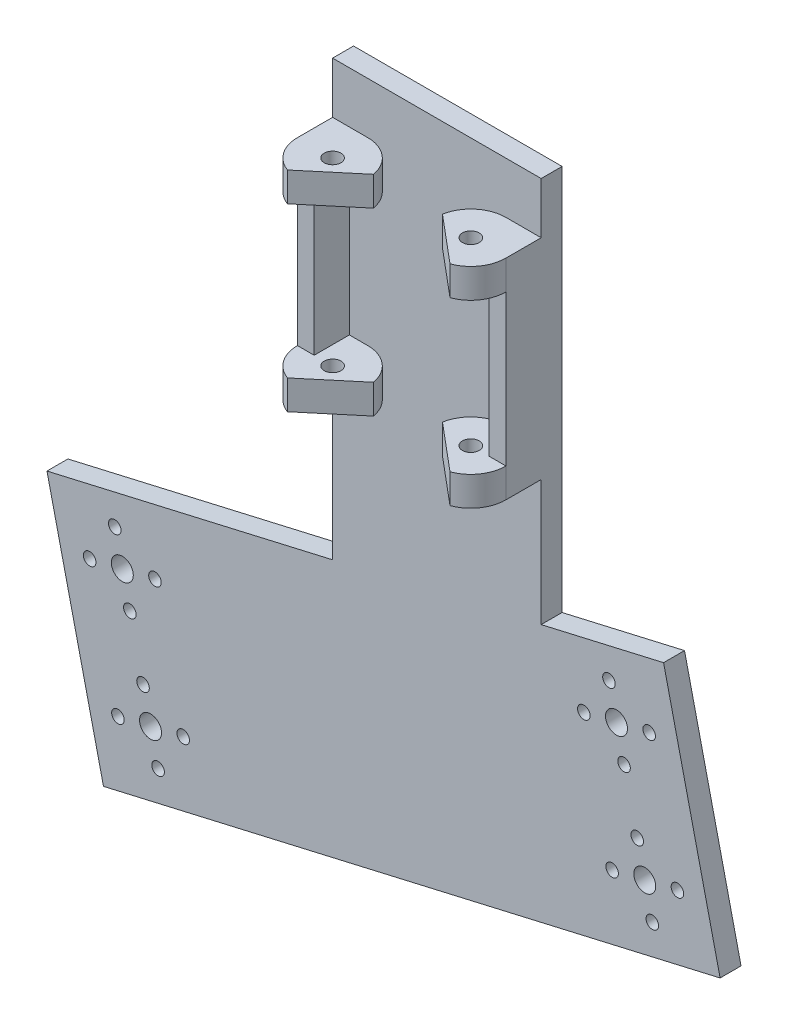
from build123d import *

# Parameters (mm, degrees)
BOSS_EXTRUDE2_DEPTH     = 7
CUT_EXTRUDE2_DEPTH      = 30.130224853
CUT_EXTRUDE2_DEPTH_BACK = 30.130224853
SKETCH3_R               = 2
BOSS_EXTRUDE3_DEPTH     = 36
SKETCH5_R               = 2
BOSS_EXTRUDE4_DEPTH     = 7
SKETCH13_W              = 49.8
SKETCH13_H              = 5
BOSS_EXTRUDE6_DEPTH     = 12.25
SKETCH15_W              = 49.8
SKETCH15_H              = 5
BOSS_EXTRUDE7_DEPTH     = 30
BOSS_EXTRUDE8_DEPTH     = 5
CUT_EXTRUDE3_DEPTH      = 150.404134049
CUT_EXTRUDE3_DEPTH_BACK = 150.404134049
SKETCH16_R              = 2.625
SKETCH16_R_2            = 1.5


with BuildPart() as part:
    # Sketch1 → Boss-Extrude2 (new body)
    with BuildSketch(Plane(origin=(0, 0, 0), x_dir=(1, 0, 0), z_dir=(0, 1, 0))):
        with BuildLine():
            Line((-24.9, 0), (-24.9, 13.4))
            Line((-24.9, 13.4), (24.9, 13.4))
            Line((24.9, 13.4), (24.9, 0))
            ThreePointArc((24.9, 0), (23.392904185, -4.800819919), (19.412411454, -7.878950407))
            Line((19.412411454, -7.878950407), (8.235013612, 1.5))
            ThreePointArc((8.235013612, 1.5), (11.116692467, 6.448255578), (16.5, 8.4))
            Line((16.5, 8.4), (-16.5, 8.4))
            ThreePointArc((-16.5, 8.4), (-11.116692467, 6.448255578), (-8.235013612, 1.5))
            Line((-8.235013612, 1.5), (-19.412411454, -7.878950407))
            ThreePointArc((-19.412411454, -7.878950407), (-23.392904185, -4.800819919), (-24.9, 0))
        make_face()
    extrude(amount=BOSS_EXTRUDE2_DEPTH)

    # Sketch3 → Cut-Extrude2 (cut, two sides: drawn at the far end of the back side and taken through both)
    with BuildSketch(Plane(origin=(0, 7, 0), x_dir=(1, 0, 0), z_dir=(0, 1, 0)).offset(-CUT_EXTRUDE2_DEPTH_BACK)):
        with Locations((-16.5, 0)):
            Circle(SKETCH3_R)
        with Locations((16.5, 0)):
            Circle(SKETCH3_R)
    extrude(amount=CUT_EXTRUDE2_DEPTH + CUT_EXTRUDE2_DEPTH_BACK, mode=Mode.SUBTRACT)

    # Sketch4 → Boss-Extrude3 (add)
    with BuildSketch(Plane(origin=(0, 7, 0), x_dir=(1, 0, 0), z_dir=(0, 1, 0))):
        Polygon((-24.9, 13.4), (-24.9, 0), (-20.9, 0), (-20.9, 8.4), (-16.5, 8.4), (16.5, 8.4), (20.9, 8.4), (20.9, 0), (24.9, 0), (24.9, 13.4), align=None)
    extrude(amount=BOSS_EXTRUDE3_DEPTH)

    # Sketch5 → Boss-Extrude4 (add)
    with BuildSketch(Plane(origin=(0, 43, 0), x_dir=(1, 0, 0), z_dir=(0, 1, 0))):
        with BuildLine():
            Line((-24.9, 13.4), (-24.9, 0))
            ThreePointArc((-24.9, 0), (-23.392904185, -4.800819919), (-19.412411454, -7.878950407))
            Line((-19.412411454, -7.878950407), (-8.235013612, 1.5))
            ThreePointArc((-8.235013612, 1.5), (-11.116692467, 6.448255578), (-16.5, 8.4))
            Line((-16.5, 8.4), (16.5, 8.4))
            ThreePointArc((16.5, 8.4), (11.116692467, 6.448255578), (8.235013612, 1.5))
            Line((8.235013612, 1.5), (19.412411454, -7.878950407))
            ThreePointArc((19.412411454, -7.878950407), (23.392904185, -4.800819919), (24.9, 0))
            Line((24.9, 0), (24.9, 13.4))
            Line((24.9, 13.4), (-24.9, 13.4))
        make_face()
        with Locations((16.5, 0)):
            Circle(SKETCH5_R, mode=Mode.SUBTRACT)
        with Locations((-16.5, 0)):
            Circle(SKETCH5_R, mode=Mode.SUBTRACT)
    extrude(amount=BOSS_EXTRUDE4_DEPTH)

    # Sketch13 → Boss-Extrude6 (add)
    with BuildSketch(Plane(origin=(0, 50, 0), x_dir=(1, 0, 0), z_dir=(0, 1, 0))):
        with Locations((0, 10.9)):
            Rectangle(SKETCH13_W, SKETCH13_H)
    extrude(amount=BOSS_EXTRUDE6_DEPTH)

    # Sketch15 → Boss-Extrude7 (add)
    with BuildSketch(Plane.XZ):
        with Locations((0, -10.9)):
            Rectangle(SKETCH15_W, SKETCH15_H)
    extrude(amount=BOSS_EXTRUDE7_DEPTH)

    # Sketch12 → Boss-Extrude8 (add)
    with BuildSketch(Plane(origin=(0, 0, -13.4), x_dir=(-1, 0, 0), z_dir=(0, 0, -1))):
        Polygon((24.9, -30), (24.9, -41.497235918), (93.105904535, -57.243809722), (79.608841274, -115.706013609), (-67.628165204, -81.713672257), (-54.131101944, -23.25146837), (-24.9, -30), align=None)
    extrude(amount=-BOSS_EXTRUDE8_DEPTH)

    # Sketch16 → Cut-Extrude3 (cut, two sides: drawn at the far end of the back side and taken through both)
    with BuildSketch(Plane.XY.offset(-8.4).offset(-CUT_EXTRUDE3_DEPTH_BACK)):
        with Locations((42.889816787, -41.241285157)):
            Circle(SKETCH16_R)
        with Locations((50.684777305, -39.441676722)):
            Circle(SKETCH16_R_2)
        with Locations((44.689425222, -49.036245675)):
            Circle(SKETCH16_R_2)
        with Locations((35.094856269, -43.040893591)):
            Circle(SKETCH16_R_2)
        with Locations((41.090208352, -33.446324638)):
            Circle(SKETCH16_R_2)
        with Locations((-82.911048266, -70.284703313)):
            Circle(SKETCH16_R_2)
        with Locations((-76.915696183, -60.69013436)):
            Circle(SKETCH16_R_2)
        with Locations((-67.32112723, -66.685486444)):
            Circle(SKETCH16_R_2)
        with Locations((-73.316479313, -76.280055397)):
            Circle(SKETCH16_R_2)
        with Locations((-75.116087748, -68.485094879)):
            Circle(SKETCH16_R)
        with Locations((47.838739983, -62.677426582)):
            Circle(SKETCH16_R_2)
        with Locations((57.433308936, -68.672778665)):
            Circle(SKETCH16_R_2)
        with Locations((51.437956852, -78.267347618)):
            Circle(SKETCH16_R_2)
        with Locations((49.638348417, -70.4723871)):
            Circle(SKETCH16_R)
        with Locations((41.843387899, -72.271995535)):
            Circle(SKETCH16_R_2)
        with Locations((-70.167164552, -89.921236304)):
            Circle(SKETCH16_R_2)
        with Locations((-68.367556118, -97.716196822)):
            Circle(SKETCH16_R)
        with Locations((-76.162516636, -99.515805257)):
            Circle(SKETCH16_R_2)
        with Locations((-66.567947683, -105.511157341)):
            Circle(SKETCH16_R_2)
        with Locations((-60.572595599, -95.916588388)):
            Circle(SKETCH16_R_2)
    extrude(amount=CUT_EXTRUDE3_DEPTH + CUT_EXTRUDE3_DEPTH_BACK, mode=Mode.SUBTRACT)


solid = part.part
